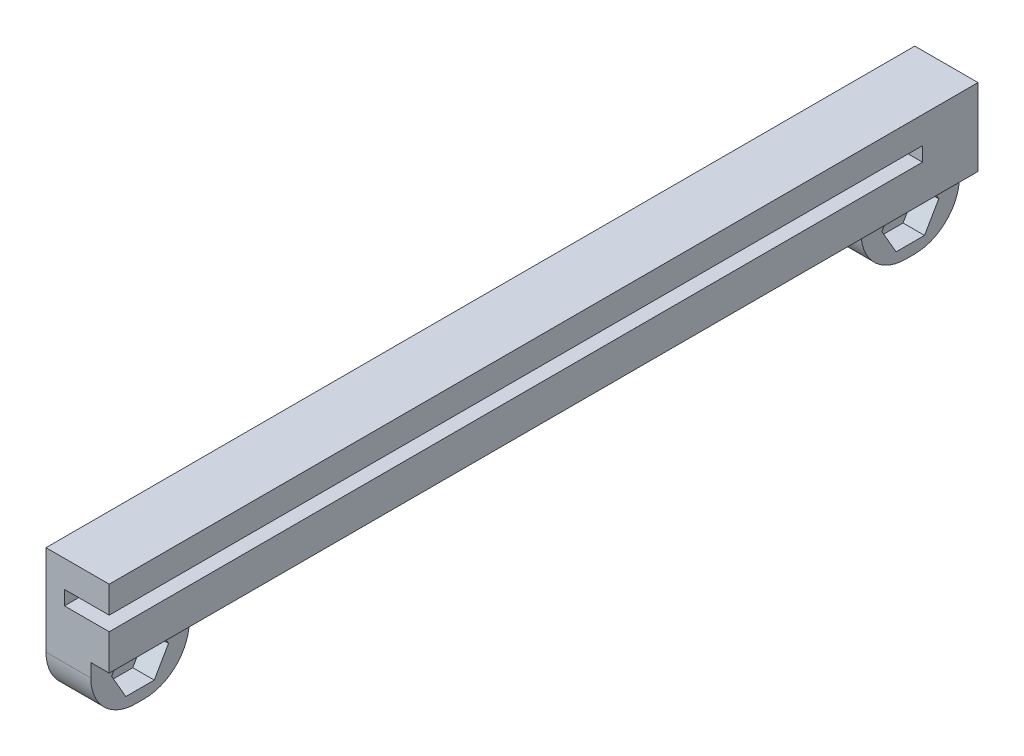
from build123d import *

# Parameters (mm, degrees)
SKETCH1_W           = 7.0575
SKETCH1_H           = 97
BOSS_EXTRUDE2_DEPTH = 7.6
SKETCH4_W           = 5
SKETCH4_H           = 90.805
CUT_EXTRUDE1_DEPTH  = 4.6
SKETCH6_W           = 5
SKETCH6_H           = 90.805
BOSS_EXTRUDE3_DEPTH = 3
SKETCH8_W           = 7.0575
SKETCH8_H           = 97
BOSS_EXTRUDE4_DEPTH = 1
SKETCH9_W           = 5
SKETCH9_H           = 11
BOSS_EXTRUDE5_DEPTH = 6.5
CUT_EXTRUDE2_DEPTH  = 2.4
SKETCH11_R          = 1.5
CUT_EXTRUDE3_DEPTH  = 50.293805962
FILLET2_R           = 5


with BuildPart() as part:
    # Sketch1 → Boss-Extrude2 (new body)
    with BuildSketch(Plane(origin=(0, 0, 0), x_dir=(1, 0, 0), z_dir=(0, 1, 0))):
        Rectangle(SKETCH1_W, SKETCH1_H)
    extrude(amount=BOSS_EXTRUDE2_DEPTH)

    # Sketch4 → Cut-Extrude1 (cut)
    with BuildSketch(Plane(origin=(0, 7.6, 0), x_dir=(1, 0, 0), z_dir=(0, 1, 0))):
        with Locations((1.02875, -3.0975)):
            Rectangle(SKETCH4_W, SKETCH4_H)
    extrude(amount=-CUT_EXTRUDE1_DEPTH, mode=Mode.SUBTRACT)

    # Sketch6 → Boss-Extrude3 (add)
    with BuildSketch(Plane(origin=(0, 7.6, 0), x_dir=(1, 0, 0), z_dir=(0, 1, 0))):
        with Locations((1.02875, -3.0975)):
            Rectangle(SKETCH6_W, SKETCH6_H)
    extrude(amount=-BOSS_EXTRUDE3_DEPTH)

    # Sketch8 → Boss-Extrude4 (add)
    with BuildSketch(Plane.XZ):
        Rectangle(SKETCH8_W, SKETCH8_H)
    extrude(amount=BOSS_EXTRUDE4_DEPTH)

    # Sketch9 → Boss-Extrude5 (add)
    with BuildSketch(Plane.XZ.offset(1)):
        with Locations((-1.02875, 43)):
            Rectangle(SKETCH9_W, SKETCH9_H)
        with Locations((-1.02875, -43)):
            Rectangle(SKETCH9_W, SKETCH9_H)
    extrude(amount=BOSS_EXTRUDE5_DEPTH)

    # Sketch10 → Cut-Extrude2 (cut)
    with BuildSketch(Plane(origin=(1.47125, 0, 0), x_dir=(0, 0, -1), z_dir=(1, 0, 0))):
        Polygon((-44.58771324, -0.75), (-46.175426481, -3.5), (-44.58771324, -6.25), (-41.41228676, -6.25), (-39.824573519, -3.5), (-41.41228676, -0.75), align=None)
        Polygon((46.175426481, -3.5), (44.58771324, -0.75), (41.41228676, -0.75), (39.824573519, -3.5), (41.41228676, -6.25), (44.58771324, -6.25), align=None)
    extrude(amount=-CUT_EXTRUDE2_DEPTH, mode=Mode.SUBTRACT)

    # Sketch11 → Cut-Extrude3 (cut, through all)
    with BuildSketch(Plane(origin=(-0.92875, 0, 0), x_dir=(0, 0, -1), z_dir=(1, 0, 0))):
        with Locations((-43, -3.5)):
            Circle(SKETCH11_R)
        with Locations((43, -3.5)):
            Circle(SKETCH11_R)
    extrude(amount=-CUT_EXTRUDE3_DEPTH, mode=Mode.SUBTRACT)

    # Fillet2
    fillet2_edges = [part.edges().sort_by_distance(p)[0] for p in [
        (-1.02875, -7.5, -48.5),
        (-1.02875, -7.5, -37.5),
        (-1.02875, -7.5, 37.5),
        (-1.02875, -7.5, 48.5),
    ]]
    fillet(fillet2_edges, radius=FILLET2_R)


solid = part.part
